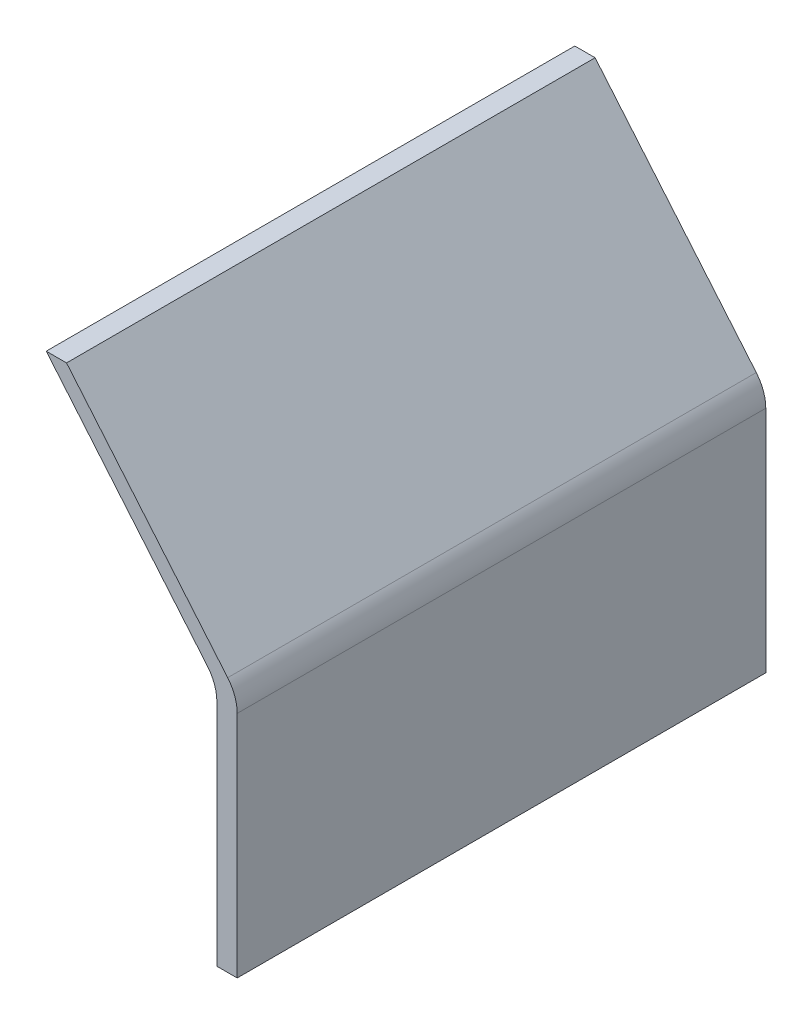
from build123d import *

# Parameters (mm, degrees)
FUNNEL_LEFT_SIDE_DEPTH = 130
FILLET1_R              = 10


with BuildPart() as part:
    # Sketch1 → Funnel - Left Side (new body)
    with BuildSketch(Plane.XY):
        Polygon((0, 0), (-5, 0), (-5, 60), (-46.974030913, 110.022702136), (-41.974030913, 110.022702136), (0, 60), align=None)
    extrude(amount=FUNNEL_LEFT_SIDE_DEPTH)

    # Fillet1
    fillet1_edges = [part.edges().sort_by_distance(p)[0] for p in [
        (0, 60, 65),
        (-5, 60, 65),
    ]]
    fillet(fillet1_edges, radius=FILLET1_R)


solid = part.part
